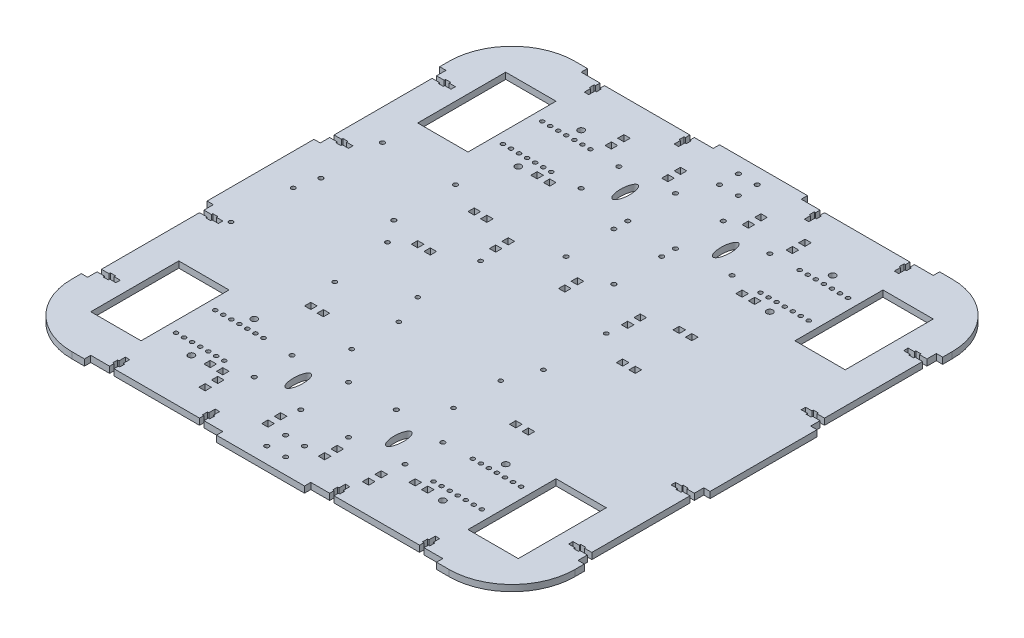
from build123d import *

# Parameters (mm, degrees)
SKETCH1_W           = 400
SKETCH1_H           = 400
SKETCH1_R           = 1.75
SKETCH1_W_2         = 40
SKETCH1_H_2         = 70
BOSS_EXTRUDE2_DEPTH = 5
FILLET1_R           = 50
SKETCH2_R           = 1.6
CUT_EXTRUDE1_DEPTH  = 5
SKETCH3_R           = 1.65
CUT_EXTRUDE2_DEPTH  = 10
SKETCH4_R           = 1.75
CUT_EXTRUDE3_DEPTH  = 10
SKETCH5_R           = 1.75
CUT_EXTRUDE4_DEPTH  = 10
SKETCH6_RX          = 10
SKETCH6_RY          = 3.75
CUT_EXTRUDE5_DEPTH  = 10
SKETCH7_R           = 1.65
CUT_EXTRUDE6_DEPTH  = 10
SKETCH8_R           = 1.65
CUT_EXTRUDE7_DEPTH  = 5
CUT_EXTRUDE8_DEPTH  = 10
SKETCH11_W          = 105
SKETCH11_H          = 5
CUT_EXTRUDE9_DEPTH  = 10
CUT_EXTRUDE10_DEPTH = 5
SKETCH13_W          = 5
SKETCH13_H          = 100
CUT_EXTRUDE11_DEPTH = 5
SKETCH14_W          = 5
SKETCH14_H          = 5
CUT_EXTRUDE12_DEPTH = 10
SKETCH15_R          = 2.5
CUT_EXTRUDE13_DEPTH = 10
SKETCH16_R          = 1.75
CUT_EXTRUDE14_DEPTH = 10


with BuildPart() as part:
    # Sketch1 → Boss-Extrude2 (new body)
    with BuildSketch(Plane(origin=(0, 0, 0), x_dir=(1, 0, 0), z_dir=(0, 1, 0))):
        Rectangle(SKETCH1_W, SKETCH1_H)
        with Locations((-7.5, 172.5)):
            Circle(SKETCH1_R, mode=Mode.SUBTRACT)
        with Locations((-7.5, 187.5)):
            Circle(SKETCH1_R, mode=Mode.SUBTRACT)
        with Locations((7.5, 172.5)):
            Circle(SKETCH1_R, mode=Mode.SUBTRACT)
        with Locations((7.5, 187.5)):
            Circle(SKETCH1_R, mode=Mode.SUBTRACT)
        with Locations((-150, -130)):
            Rectangle(SKETCH1_W_2, SKETCH1_H_2, mode=Mode.SUBTRACT)
        with Locations((150, -130)):
            Rectangle(SKETCH1_W_2, SKETCH1_H_2, mode=Mode.SUBTRACT)
        with Locations((-150, 130)):
            Rectangle(SKETCH1_W_2, SKETCH1_H_2, mode=Mode.SUBTRACT)
        with Locations((150, 130)):
            Rectangle(SKETCH1_W_2, SKETCH1_H_2, mode=Mode.SUBTRACT)
        with Locations((-7.5, -187.5)):
            Circle(SKETCH1_R, mode=Mode.SUBTRACT)
        with Locations((-7.5, -172.5)):
            Circle(SKETCH1_R, mode=Mode.SUBTRACT)
        with Locations((7.5, -187.5)):
            Circle(SKETCH1_R, mode=Mode.SUBTRACT)
        with Locations((7.5, -172.5)):
            Circle(SKETCH1_R, mode=Mode.SUBTRACT)
    extrude(amount=BOSS_EXTRUDE2_DEPTH)

    # Fillet1
    fillet1_edges = [part.edges().sort_by_distance(p)[0] for p in [
        (200, 2.5, -200),
        (200, 2.5, 200),
        (-200, 2.5, 200),
        (-200, 2.5, -200),
    ]]
    fillet(fillet1_edges, radius=FILLET1_R)

    # Sketch2 → Cut-Extrude1 (cut)
    with BuildSketch(Plane(origin=(0, 5, 0), x_dir=(1, 0, 0), z_dir=(0, 1, 0))):
        with Locations((-121.6, 145.6)):
            Circle(SKETCH2_R)
        with Locations((-115.2, 145.6)):
            Circle(SKETCH2_R)
        with Locations((-108.8, 145.6)):
            Circle(SKETCH2_R)
        with Locations((-102.4, 145.6)):
            Circle(SKETCH2_R)
        with Locations((-96, 145.6)):
            Circle(SKETCH2_R)
        with Locations((-89.6, 145.6)):
            Circle(SKETCH2_R)
        with Locations((-83.2, 145.6)):
            Circle(SKETCH2_R)
        with Locations((-83.2, 114.4)):
            Circle(SKETCH2_R)
        with Locations((-89.6, 114.4)):
            Circle(SKETCH2_R)
        with Locations((-96, 114.4)):
            Circle(SKETCH2_R)
        with Locations((-102.4, 114.4)):
            Circle(SKETCH2_R)
        with Locations((-108.8, 114.4)):
            Circle(SKETCH2_R)
        with Locations((-115.2, 114.4)):
            Circle(SKETCH2_R)
        with Locations((-121.6, 114.4)):
            Circle(SKETCH2_R)
        with Locations((83.2, 114.4)):
            Circle(SKETCH2_R)
        with Locations((89.6, 114.4)):
            Circle(SKETCH2_R)
        with Locations((96, 114.4)):
            Circle(SKETCH2_R)
        with Locations((102.4, 114.4)):
            Circle(SKETCH2_R)
        with Locations((108.8, 114.4)):
            Circle(SKETCH2_R)
        with Locations((115.2, 114.4)):
            Circle(SKETCH2_R)
        with Locations((121.6, 114.4)):
            Circle(SKETCH2_R)
        with Locations((83.2, 145.6)):
            Circle(SKETCH2_R)
        with Locations((89.6, 145.6)):
            Circle(SKETCH2_R)
        with Locations((96, 145.6)):
            Circle(SKETCH2_R)
        with Locations((102.4, 145.6)):
            Circle(SKETCH2_R)
        with Locations((108.8, 145.6)):
            Circle(SKETCH2_R)
        with Locations((115.2, 145.6)):
            Circle(SKETCH2_R)
        with Locations((121.6, 145.6)):
            Circle(SKETCH2_R)
        with Locations((121.6, -145.6)):
            Circle(SKETCH2_R)
        with Locations((115.2, -145.6)):
            Circle(SKETCH2_R)
        with Locations((108.8, -145.6)):
            Circle(SKETCH2_R)
        with Locations((102.4, -145.6)):
            Circle(SKETCH2_R)
        with Locations((96, -145.6)):
            Circle(SKETCH2_R)
        with Locations((89.6, -145.6)):
            Circle(SKETCH2_R)
        with Locations((83.2, -145.6)):
            Circle(SKETCH2_R)
        with Locations((121.6, -114.4)):
            Circle(SKETCH2_R)
        with Locations((115.2, -114.4)):
            Circle(SKETCH2_R)
        with Locations((108.8, -114.4)):
            Circle(SKETCH2_R)
        with Locations((102.4, -114.4)):
            Circle(SKETCH2_R)
        with Locations((96, -114.4)):
            Circle(SKETCH2_R)
        with Locations((89.6, -114.4)):
            Circle(SKETCH2_R)
        with Locations((83.2, -114.4)):
            Circle(SKETCH2_R)
        with Locations((-121.6, -114.4)):
            Circle(SKETCH2_R)
        with Locations((-115.2, -114.4)):
            Circle(SKETCH2_R)
        with Locations((-108.8, -114.4)):
            Circle(SKETCH2_R)
        with Locations((-102.4, -114.4)):
            Circle(SKETCH2_R)
        with Locations((-96, -114.4)):
            Circle(SKETCH2_R)
        with Locations((-89.6, -114.4)):
            Circle(SKETCH2_R)
        with Locations((-83.2, -114.4)):
            Circle(SKETCH2_R)
        with Locations((-83.2, -145.6)):
            Circle(SKETCH2_R)
        with Locations((-89.6, -145.6)):
            Circle(SKETCH2_R)
        with Locations((-96, -145.6)):
            Circle(SKETCH2_R)
        with Locations((-102.4, -145.6)):
            Circle(SKETCH2_R)
        with Locations((-108.8, -145.6)):
            Circle(SKETCH2_R)
        with Locations((-115.2, -145.6)):
            Circle(SKETCH2_R)
        with Locations((-121.6, -145.6)):
            Circle(SKETCH2_R)
    extrude(amount=-CUT_EXTRUDE1_DEPTH, mode=Mode.SUBTRACT)

    # Sketch3 → Cut-Extrude2 (cut)
    with BuildSketch(Plane(origin=(0, 5, 0), x_dir=(1, 0, 0), z_dir=(0, 1, 0))):
        with Locations((-176.03, -47.46)):
            Circle(SKETCH3_R)
        with Locations((-174.76, 0.8)):
            Circle(SKETCH3_R)
        with Locations((-93.48, -47.46)):
            Circle(SKETCH3_R)
        with Locations((-99.83, 0.8)):
            Circle(SKETCH3_R)
    extrude(amount=-CUT_EXTRUDE2_DEPTH, mode=Mode.SUBTRACT)

    # Sketch4 → Cut-Extrude3 (cut)
    with BuildSketch(Plane(origin=(0, 5, 0), x_dir=(1, 0, 0), z_dir=(0, 1, 0))):
        with Locations((-19, 149)):
            Circle(SKETCH4_R)
        with Locations((19, 149)):
            Circle(SKETCH4_R)
        with Locations((19, 111)):
            Circle(SKETCH4_R)
        with Locations((-19, 111)):
            Circle(SKETCH4_R)
        with Locations((-19, 100)):
            Circle(SKETCH4_R)
        with Locations((19, 100)):
            Circle(SKETCH4_R)
        with Locations((19, 62)):
            Circle(SKETCH4_R)
        with Locations((-19, 62)):
            Circle(SKETCH4_R)
        with Locations((-19, -149)):
            Circle(SKETCH4_R)
        with Locations((19, -149)):
            Circle(SKETCH4_R)
        with Locations((-19, -111)):
            Circle(SKETCH4_R)
        with Locations((19, -111)):
            Circle(SKETCH4_R)
    extrude(amount=-CUT_EXTRUDE3_DEPTH, mode=Mode.SUBTRACT)

    # Sketch5 → Cut-Extrude4 (cut)
    with BuildSketch(Plane(origin=(0, 5, 0), x_dir=(1, 0, 0), z_dir=(0, 1, 0))):
        with Locations((-170.5, 67.5)):
            Circle(SKETCH5_R)
        with Locations((-112.5, 67.5)):
            Circle(SKETCH5_R)
        with Locations((-112.5, 18.5)):
            Circle(SKETCH5_R)
        with Locations((-170.5, 18.5)):
            Circle(SKETCH5_R)
    extrude(amount=-CUT_EXTRUDE4_DEPTH, mode=Mode.SUBTRACT)

    # Sketch6 → Cut-Extrude5 (cut)
    with BuildSketch(Plane(origin=(0, 5, 0), x_dir=(1, 0, 0), z_dir=(0, 1, 0))):
        with Locations(Location((-40, 130), (0, 0, 90))):
            Ellipse(SKETCH6_RX, SKETCH6_RY)
        with Locations(Location((40, 130), (0, 0, 90))):
            Ellipse(SKETCH6_RX, SKETCH6_RY)
        with Locations(Location((40, -130), (0, 0, -90))):
            Ellipse(SKETCH6_RX, SKETCH6_RY)
        with Locations(Location((-40, -130), (0, 0, -90))):
            Ellipse(SKETCH6_RX, SKETCH6_RY)
    extrude(amount=-CUT_EXTRUDE5_DEPTH, mode=Mode.SUBTRACT)

    # Sketch7 → Cut-Extrude6 (cut)
    with BuildSketch(Plane(origin=(0, 5, 0), x_dir=(1, 0, 0), z_dir=(0, 1, 0))):
        with Locations((-50, 25)):
            Circle(SKETCH7_R)
        with Locations((50, 25)):
            Circle(SKETCH7_R)
        with Locations((50, -25)):
            Circle(SKETCH7_R)
        with Locations((-50, -25)):
            Circle(SKETCH7_R)
    extrude(amount=-CUT_EXTRUDE6_DEPTH, mode=Mode.SUBTRACT)

    # Sketch8 → Cut-Extrude7 (cut)
    with BuildSketch(Plane(origin=(0, 5, 0), x_dir=(1, 0, 0), z_dir=(0, 1, 0))):
        with Locations((-40.5, -49.5)):
            Circle(SKETCH8_R)
        with Locations((40.5, -49.5)):
            Circle(SKETCH8_R)
        with Locations((40.5, -87)):
            Circle(SKETCH8_R)
        with Locations((-40.5, -87)):
            Circle(SKETCH8_R)
    extrude(amount=-CUT_EXTRUDE7_DEPTH, mode=Mode.SUBTRACT)

    # Sketch10 → Cut-Extrude8 (cut)
    with BuildSketch(Plane(origin=(0, 5, 0), x_dir=(1, 0, 0), z_dir=(0, 1, 0))):
        Polygon((-125, -200), (-121.5, -200), (-121.5, -191.5), (-120.4, -191.5), (-120.4, -187.5), (-121.5, -187.5), (-121.5, -182.5), (-125, -182.5), (-125, -187.5), (-126.1, -187.5), (-126.1, -191.5), (-125, -191.5), align=None)
        Polygon((-53.5, -200), (-50, -200), (-50, -191.5), (-48.9, -191.5), (-48.9, -187.5), (-50, -187.5), (-50, -182.5), (-53.5, -182.5), (-53.5, -187.5), (-54.6, -187.5), (-54.6, -191.5), (-53.5, -191.5), align=None)
        Polygon((125, -200), (125, -191.5), (126.1, -191.5), (126.1, -187.5), (125, -187.5), (125, -182.5), (121.5, -182.5), (121.5, -187.5), (120.4, -187.5), (120.4, -191.5), (121.5, -191.5), (121.5, -200), align=None)
        Polygon((53.5, -200), (53.5, -191.5), (54.6, -191.5), (54.6, -187.5), (53.5, -187.5), (53.5, -182.5), (50, -182.5), (50, -187.5), (48.9, -187.5), (48.9, -191.5), (50, -191.5), (50, -200), align=None)
        Polygon((125, 200), (121.5, 200), (121.5, 191.5), (120.4, 191.5), (120.4, 187.5), (121.5, 187.5), (121.5, 182.5), (125, 182.5), (125, 187.5), (126.1, 187.5), (126.1, 191.5), (125, 191.5), align=None)
        Polygon((53.5, 200), (50, 200), (50, 191.5), (48.9, 191.5), (48.9, 187.5), (50, 187.5), (50, 182.5), (53.5, 182.5), (53.5, 187.5), (54.6, 187.5), (54.6, 191.5), (53.5, 191.5), align=None)
        Polygon((-53.5, 200), (-53.5, 191.5), (-54.6, 191.5), (-54.6, 187.5), (-53.5, 187.5), (-53.5, 182.5), (-50, 182.5), (-50, 187.5), (-48.9, 187.5), (-48.9, 191.5), (-50, 191.5), (-50, 200), align=None)
        Polygon((-125, 200), (-125, 191.5), (-126.1, 191.5), (-126.1, 187.5), (-125, 187.5), (-125, 182.5), (-121.5, 182.5), (-121.5, 187.5), (-120.4, 187.5), (-120.4, 191.5), (-121.5, 191.5), (-121.5, 200), align=None)
    extrude(amount=-CUT_EXTRUDE8_DEPTH, mode=Mode.SUBTRACT)

    # Sketch11 → Cut-Extrude9 (cut)
    with BuildSketch(Plane(origin=(0, 5, 0), x_dir=(1, 0, 0), z_dir=(0, 1, 0))):
        with Locations((-87.5, -197.5)):
            Rectangle(SKETCH11_W, SKETCH11_H)
        with Locations((87.5, -197.5)):
            Rectangle(SKETCH11_W, SKETCH11_H)
        with Locations((87.5, 197.5)):
            Rectangle(SKETCH11_W, SKETCH11_H)
        with Locations((-87.5, 197.5)):
            Rectangle(SKETCH11_W, SKETCH11_H)
    extrude(amount=-CUT_EXTRUDE9_DEPTH, mode=Mode.SUBTRACT)

    # Sketch12 → Cut-Extrude10 (cut)
    with BuildSketch(Plane(origin=(0, 5, 0), x_dir=(1, 0, 0), z_dir=(0, 1, 0))):
        Polygon((-200, 135), (-189, 135), (-189, 136.1), (-185, 136.1), (-185, 135), (-180, 135), (-180, 131.5), (-185, 131.5), (-185, 130.4), (-189, 130.4), (-189, 131.5), (-200, 131.5), align=None)
        Polygon((-200, 53.5), (-189, 53.5), (-189, 54.6), (-185, 54.6), (-185, 53.5), (-180, 53.5), (-180, 50), (-185, 50), (-185, 48.9), (-189, 48.9), (-189, 50), (-200, 50), align=None)
        Polygon((-200, -53.5), (-200, -50), (-189, -50), (-189, -48.9), (-185, -48.9), (-185, -50), (-180, -50), (-180, -53.5), (-185, -53.5), (-185, -54.6), (-189, -54.6), (-189, -53.5), align=None)
        Polygon((-200, -135), (-200, -131.5), (-189, -131.5), (-189, -130.4), (-185, -130.4), (-185, -131.5), (-180, -131.5), (-180, -135), (-185, -135), (-185, -136.1), (-189, -136.1), (-189, -135), align=None)
        Polygon((200, -135), (189, -135), (189, -136.1), (185, -136.1), (185, -135), (180, -135), (180, -131.5), (185, -131.5), (185, -130.4), (189, -130.4), (189, -131.5), (200, -131.5), align=None)
        Polygon((200, -53.5), (189, -53.5), (189, -54.6), (185, -54.6), (185, -53.5), (180, -53.5), (180, -50), (185, -50), (185, -48.9), (189, -48.9), (189, -50), (200, -50), align=None)
        Polygon((200, 53.5), (200, 50), (189, 50), (189, 48.9), (185, 48.9), (185, 50), (180, 50), (180, 53.5), (185, 53.5), (185, 54.6), (189, 54.6), (189, 53.5), align=None)
        Polygon((200, 135), (200, 131.5), (189, 131.5), (189, 130.4), (185, 130.4), (185, 131.5), (180, 131.5), (180, 135), (185, 135), (185, 136.1), (189, 136.1), (189, 135), align=None)
    extrude(amount=-CUT_EXTRUDE10_DEPTH, mode=Mode.SUBTRACT)

    # Sketch13 → Cut-Extrude11 (cut)
    with BuildSketch(Plane(origin=(0, 5, 0), x_dir=(1, 0, 0), z_dir=(0, 1, 0))):
        with Locations((-197.5, 92.5)):
            Rectangle(SKETCH13_W, SKETCH13_H)
        with Locations((-197.5, -92.5)):
            Rectangle(SKETCH13_W, SKETCH13_H)
        with Locations((197.5, -92.5)):
            Rectangle(SKETCH13_W, SKETCH13_H)
        with Locations((197.5, 92.5)):
            Rectangle(SKETCH13_W, SKETCH13_H)
    extrude(amount=-CUT_EXTRUDE11_DEPTH, mode=Mode.SUBTRACT)

    # Sketch14 → Cut-Extrude12 (cut)
    with BuildSketch(Plane(origin=(0, 5, 0), x_dir=(1, 0, 0), z_dir=(0, 1, 0))):
        with Locations((31.5, 166.5)):
            Rectangle(SKETCH14_W, SKETCH14_H)
        with Locations((31.5, 156.5)):
            Rectangle(SKETCH14_W, SKETCH14_H)
        with Locations((66.5, 166.5)):
            Rectangle(SKETCH14_W, SKETCH14_H)
        with Locations((66.5, 156.5)):
            Rectangle(SKETCH14_W, SKETCH14_H)
        with Locations((2.5, 49.5)):
            Rectangle(SKETCH14_W, SKETCH14_H)
        with Locations((2.5, 39.5)):
            Rectangle(SKETCH14_W, SKETCH14_H)
        with Locations((52.5, 49.5)):
            Rectangle(SKETCH14_W, SKETCH14_H)
        with Locations((52.5, 39.5)):
            Rectangle(SKETCH14_W, SKETCH14_H)
        with Locations((22.5, -161.5)):
            Rectangle(SKETCH14_W, SKETCH14_H)
        with Locations((22.5, -171.5)):
            Rectangle(SKETCH14_W, SKETCH14_H)
        with Locations((57.5, -161.5)):
            Rectangle(SKETCH14_W, SKETCH14_H)
        with Locations((57.5, -171.5)):
            Rectangle(SKETCH14_W, SKETCH14_H)
        with Locations((-32.5, 166.5)):
            Rectangle(SKETCH14_W, SKETCH14_H)
        with Locations((-32.5, 156.5)):
            Rectangle(SKETCH14_W, SKETCH14_H)
        with Locations((-52.5, 49.5)):
            Rectangle(SKETCH14_W, SKETCH14_H)
        with Locations((-52.5, 39.5)):
            Rectangle(SKETCH14_W, SKETCH14_H)
        with Locations((-22.5, -161.5)):
            Rectangle(SKETCH14_W, SKETCH14_H)
        with Locations((-22.5, -171.5)):
            Rectangle(SKETCH14_W, SKETCH14_H)
        with Locations((-77.5, 166.5)):
            Rectangle(SKETCH14_W, SKETCH14_H)
        with Locations((-77.5, 156.5)):
            Rectangle(SKETCH14_W, SKETCH14_H)
        with Locations((-72.5, -161.5)):
            Rectangle(SKETCH14_W, SKETCH14_H)
        with Locations((-72.5, -171.5)):
            Rectangle(SKETCH14_W, SKETCH14_H)
        with Locations((76.5, -153.5)):
            Rectangle(SKETCH14_W, SKETCH14_H)
        with Locations((86.5, -153.5)):
            Rectangle(SKETCH14_W, SKETCH14_H)
        with Locations((76.5, -73.5)):
            Rectangle(SKETCH14_W, SKETCH14_H)
        with Locations((86.5, -73.5)):
            Rectangle(SKETCH14_W, SKETCH14_H)
        with Locations((76.5, 11.5)):
            Rectangle(SKETCH14_W, SKETCH14_H)
        with Locations((86.5, 11.5)):
            Rectangle(SKETCH14_W, SKETCH14_H)
        with Locations((76.5, 56.5)):
            Rectangle(SKETCH14_W, SKETCH14_H)
        with Locations((86.5, 56.5)):
            Rectangle(SKETCH14_W, SKETCH14_H)
        with Locations((76.5, 106.5)):
            Rectangle(SKETCH14_W, SKETCH14_H)
        with Locations((86.5, 106.5)):
            Rectangle(SKETCH14_W, SKETCH14_H)
        with Locations((-76.5, 106.5)):
            Rectangle(SKETCH14_W, SKETCH14_H)
        with Locations((-86.5, 106.5)):
            Rectangle(SKETCH14_W, SKETCH14_H)
        with Locations((-76.5, 56.5)):
            Rectangle(SKETCH14_W, SKETCH14_H)
        with Locations((-86.5, 56.5)):
            Rectangle(SKETCH14_W, SKETCH14_H)
        with Locations((-76.5, 11.5)):
            Rectangle(SKETCH14_W, SKETCH14_H)
        with Locations((-86.5, 11.5)):
            Rectangle(SKETCH14_W, SKETCH14_H)
        with Locations((-76.5, -73.5)):
            Rectangle(SKETCH14_W, SKETCH14_H)
        with Locations((-86.5, -73.5)):
            Rectangle(SKETCH14_W, SKETCH14_H)
        with Locations((-76.5, -153.5)):
            Rectangle(SKETCH14_W, SKETCH14_H)
        with Locations((-86.5, -153.5)):
            Rectangle(SKETCH14_W, SKETCH14_H)
    extrude(amount=-CUT_EXTRUDE12_DEPTH, mode=Mode.SUBTRACT)

    # Sketch15 → Cut-Extrude13 (cut)
    with BuildSketch(Plane(origin=(0, 5, 0), x_dir=(1, 0, 0), z_dir=(0, 1, 0))):
        with Locations((-100, 105)):
            Circle(SKETCH15_R)
        with Locations((-100, 155)):
            Circle(SKETCH15_R)
        with Locations((100, 155)):
            Circle(SKETCH15_R)
        with Locations((100, 105)):
            Circle(SKETCH15_R)
        with Locations((100, -105)):
            Circle(SKETCH15_R)
        with Locations((100, -155)):
            Circle(SKETCH15_R)
        with Locations((-100, -155)):
            Circle(SKETCH15_R)
        with Locations((-100, -105)):
            Circle(SKETCH15_R)
    extrude(amount=-CUT_EXTRUDE13_DEPTH, mode=Mode.SUBTRACT)

    # Sketch16 → Cut-Extrude14 (cut)
    with BuildSketch(Plane(origin=(0, 5, 0), x_dir=(1, 0, 0), z_dir=(0, 1, 0))):
        with Locations((-60, 145)):
            Circle(SKETCH16_R)
        with Locations((-60, 115)):
            Circle(SKETCH16_R)
        with Locations((60, 115)):
            Circle(SKETCH16_R)
        with Locations((60, 145)):
            Circle(SKETCH16_R)
        with Locations((60, -115)):
            Circle(SKETCH16_R)
        with Locations((60, -145)):
            Circle(SKETCH16_R)
        with Locations((-60, -145)):
            Circle(SKETCH16_R)
        with Locations((-60, -115)):
            Circle(SKETCH16_R)
    extrude(amount=-CUT_EXTRUDE14_DEPTH, mode=Mode.SUBTRACT)


solid = part.part
